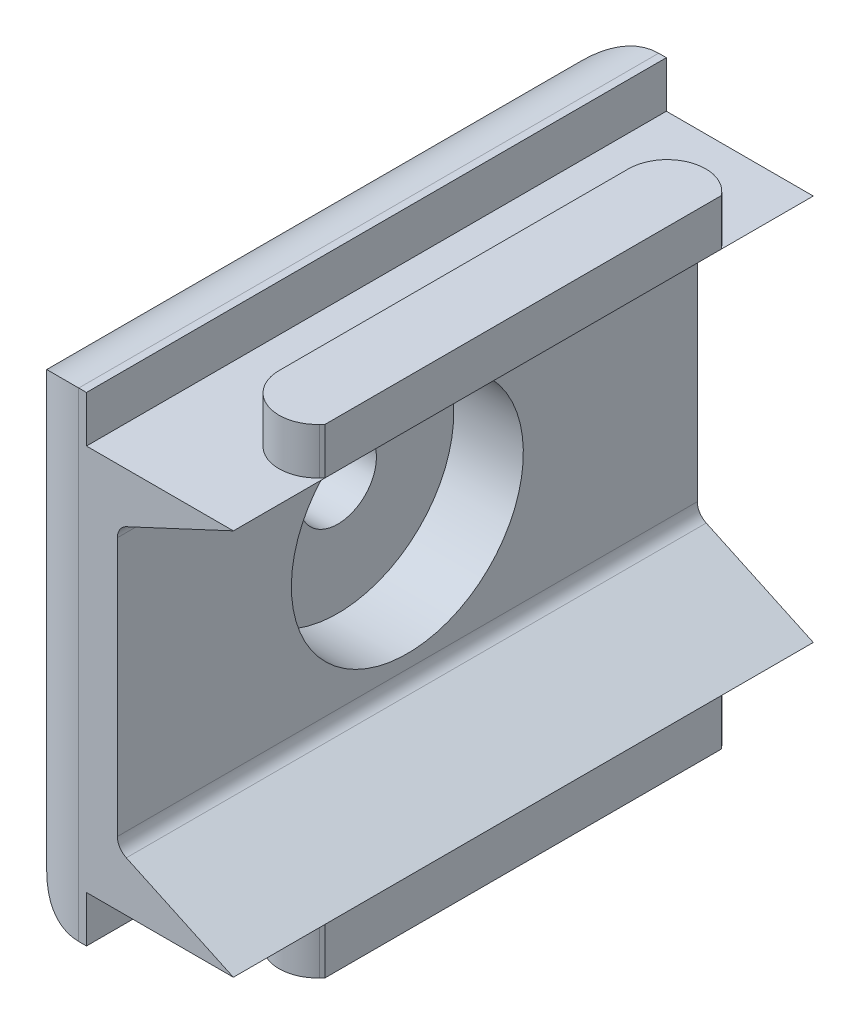
from build123d import *

# Parameters (mm, degrees)
BOSS_EXTRUDE1_DEPTH = 75
SKETCH2_R           = 5
CUT_EXTRUDE1_DEPTH  = 96
SKETCH3_R           = 15
CUT_EXTRUDE2_DEPTH  = 9
BOSS_EXTRUDE2_DEPTH = 6
FILLET1_R           = 5
BOSS_EXTRUDE3_DEPTH = 6
SKETCH6_W           = 11
SKETCH6_H           = 75
BOSS_EXTRUDE4_DEPTH = 6
SKETCH7_W           = 11
SKETCH7_H           = 75
BOSS_EXTRUDE5_DEPTH = 6
FILLET2_R           = 10
FILLET6_R           = 2


with BuildPart() as part:
    # Sketch1 → Boss-Extrude1 (new body)
    with BuildSketch(Plane.XY):
        Polygon((0, 0), (0, 50), (30, 50), (15, 43.005385128), (15, 6.994614872), (30, 0), align=None)
    extrude(amount=BOSS_EXTRUDE1_DEPTH)

    # Sketch2 → Cut-Extrude1 (cut, through all)
    with BuildSketch(Plane.ZY):
        with Locations((37.5, 25)):
            Circle(SKETCH2_R)
    extrude(amount=-CUT_EXTRUDE1_DEPTH, mode=Mode.SUBTRACT)

    # Sketch3 → Cut-Extrude2 (cut)
    with BuildSketch(Plane(origin=(15, 0, 0), x_dir=(0, 0, -1), z_dir=(1, 0, 0))):
        with Locations((-37.5, 25)):
            Circle(SKETCH3_R)
    extrude(amount=-CUT_EXTRUDE2_DEPTH, mode=Mode.SUBTRACT)

    # Sketch4 → Boss-Extrude2 (add)
    with BuildSketch(Plane(origin=(0, 50, 0), x_dir=(1, 0, 0), z_dir=(0, 1, 0))):
        Polygon((21, -37.5), (21, -2.295), (30, -11.858936533), (30, -63.141063467), (21, -72.705), align=None)
    extrude(amount=BOSS_EXTRUDE2_DEPTH)

    # Fillet1
    fillet1_edges = [part.edges().sort_by_distance(p)[0] for p in [
        (21, 53, 2.295),
        (21, 53, 72.705),
    ]]
    fillet(fillet1_edges, radius=FILLET1_R)

    # Sketch5 → Boss-Extrude3 (add)
    with BuildSketch(Plane.XZ):
        with BuildLine():
            Line((21, 60.095734792), (21, 14.904265208))
            ThreePointArc((21, 14.904265208), (24.15694334, 10.256347164), (29.641256859, 11.477714685))
            Line((29.641256859, 11.477714685), (30, 11.858936533))
            Line((30, 11.858936533), (30, 63.141063467))
            Line((30, 63.141063467), (29.641256859, 63.522285315))
            ThreePointArc((29.641256859, 63.522285315), (24.15694334, 64.743652836), (21, 60.095734792))
        make_face()
    extrude(amount=BOSS_EXTRUDE3_DEPTH)

    # Sketch6 → Boss-Extrude4 (add)
    with BuildSketch(Plane(origin=(0, 50, 0), x_dir=(1, 0, 0), z_dir=(0, 1, 0))):
        with Locations((5.5, -37.5)):
            Rectangle(SKETCH6_W, SKETCH6_H)
    extrude(amount=BOSS_EXTRUDE4_DEPTH)

    # Sketch7 → Boss-Extrude5 (add)
    with BuildSketch(Plane.XZ):
        with Locations((5.5, 37.5)):
            Rectangle(SKETCH7_W, SKETCH7_H)
    extrude(amount=BOSS_EXTRUDE5_DEPTH)

    # Fillet2
    fillet2_edges = [part.edges().sort_by_distance(p)[0] for p in [
        (0, 56, 37.5),
        (0, 25, 75),
        (0, 25, 0),
        (0, -6, 37.5),
    ]]
    fillet(fillet2_edges, radius=FILLET2_R)

    # Fillet6
    fillet6_edges = [part.edges().sort_by_distance(p)[0] for p in [
        (15, 6.994614872, 37.5),
        (15, 43.005385128, 37.5),
    ]]
    fillet(fillet6_edges, radius=FILLET6_R)


solid = part.part
